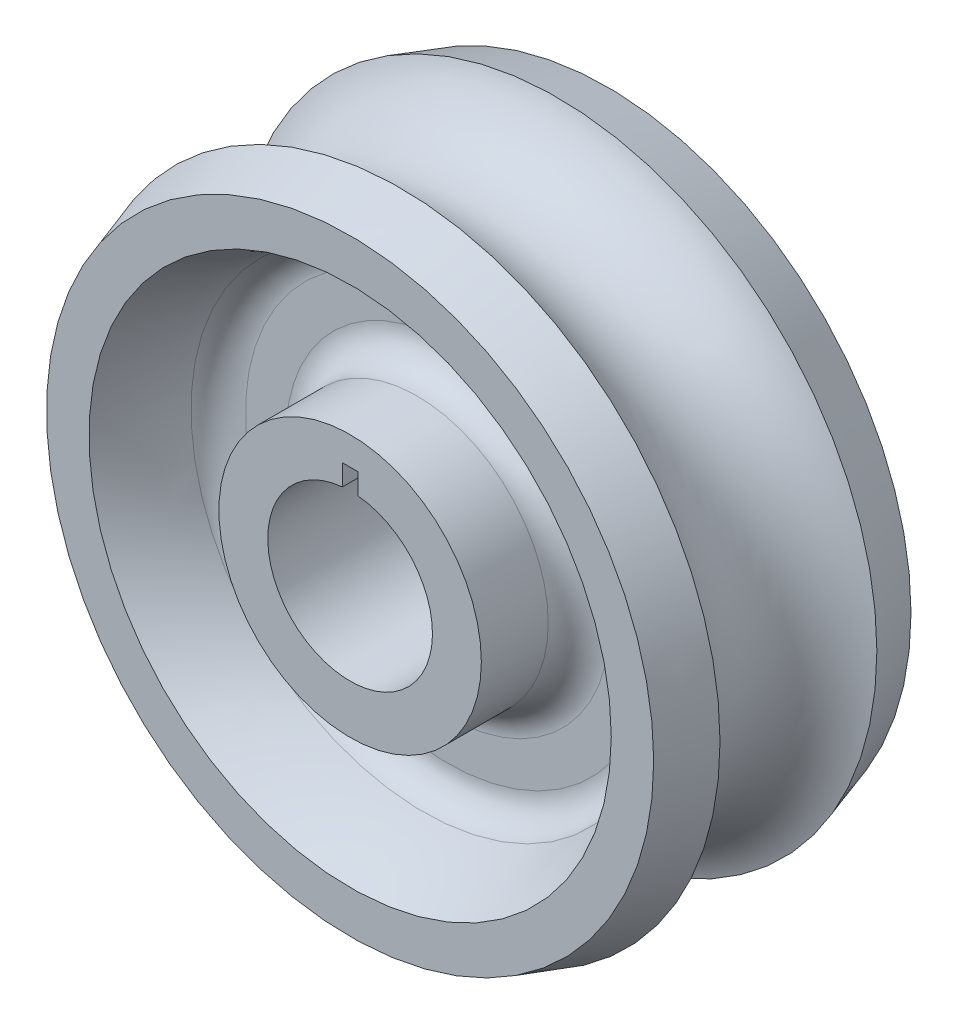
from build123d import *

# Parameters (mm, degrees)
CUT_EXTRUDE1_DEPTH = 51.543744576


with BuildPart() as part:
    # Sketch1 → Base-Revolve (revolve)
    with BuildSketch(Plane(origin=(0, 0, 0), x_dir=(0, 0, -1), z_dir=(1, 0, 0))):
        with BuildLine():
            Line((-12.5, 8), (12.5, 8))
            Line((12.5, 8), (12.5, 12.75))
            Line((12.5, 12.75), (6, 12.75))
            ThreePointArc((6, 12.75), (3.878679656, 13.628679656), (3, 15.75))
            Line((3, 15.75), (3, 19.676046432))
            ThreePointArc((3, 19.676046432), (3.662418833, 21.556395944), (5.357142857, 22.606359503))
            ThreePointArc((5.357142857, 22.606359503), (9.035249322, 23.715459855), (12.5, 25.375))
            Line((12.5, 25.375), (12.5, 29.5))
            Line((12.5, 29.5), (7.619393178, 31.061794183))
            ThreePointArc((7.619393178, 31.061794183), (0, 25.5), (-7.619393178, 31.061794183))
            Line((-7.619393178, 31.061794183), (-12.5, 29.5))
            Line((-12.5, 29.5), (-12.5, 25.375))
            ThreePointArc((-12.5, 25.375), (-9.035249322, 23.715459855), (-5.357142857, 22.606359503))
            ThreePointArc((-5.357142857, 22.606359503), (-3.662418833, 21.556395944), (-3, 19.676046432))
            Line((-3, 19.676046432), (-3, 15.75))
            ThreePointArc((-3, 15.75), (-3.878679656, 13.628679656), (-6, 12.75))
            Line((-6, 12.75), (-12.5, 12.75))
            Line((-12.5, 12.75), (-12.5, 8))
        make_face()
    revolve(axis=Axis((0, 0, 0), (0, 0, -1)))

    # Sketch2 → Cut-Extrude1 (cut, through all)
    with BuildSketch(Plane.XY.offset(12.5)):
        with BuildLine():
            Line((-0.75, 7.964766161), (-0.75, 10))
            Line((-0.75, 10), (0.75, 10))
            Line((0.75, 10), (0.75, 7.964766161))
            ThreePointArc((0.75, 7.964766161), (0, 8), (-0.75, 7.964766161))
        make_face()
    extrude(amount=-CUT_EXTRUDE1_DEPTH, mode=Mode.SUBTRACT)


solid = part.part
